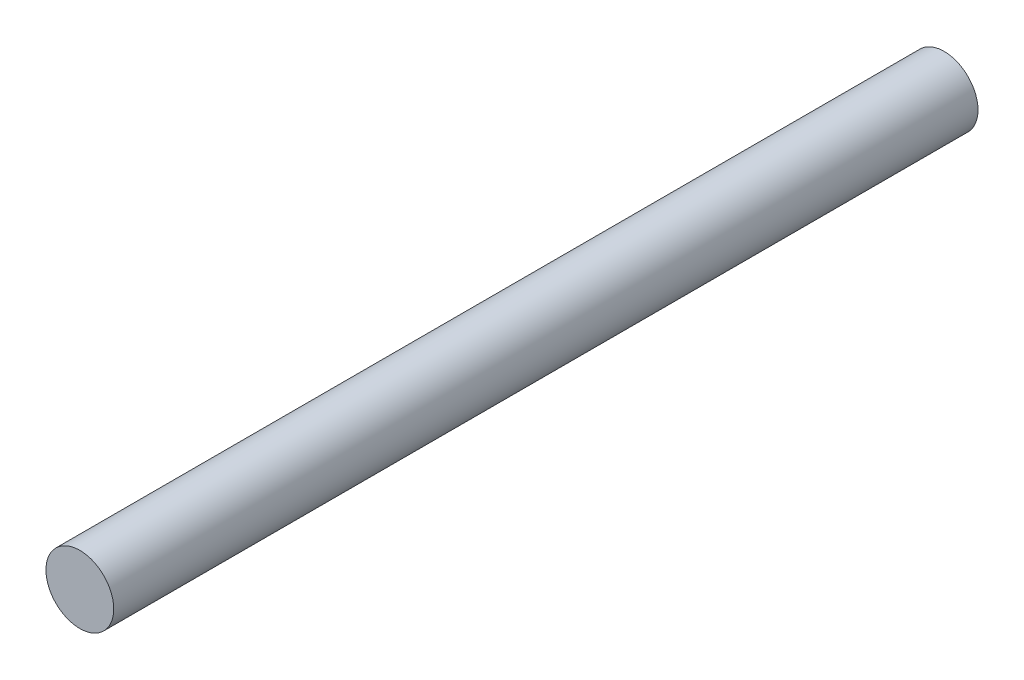
from build123d import *

# Parameters (mm, degrees)
SKETCH1_R           = 20
BOSS_EXTRUDE1_DEPTH = 510


with BuildPart() as part:
    # Sketch1 → Boss-Extrude1 (new body)
    with BuildSketch(Plane.XY):
        Circle(SKETCH1_R)
    extrude(amount=BOSS_EXTRUDE1_DEPTH)


solid = part.part
